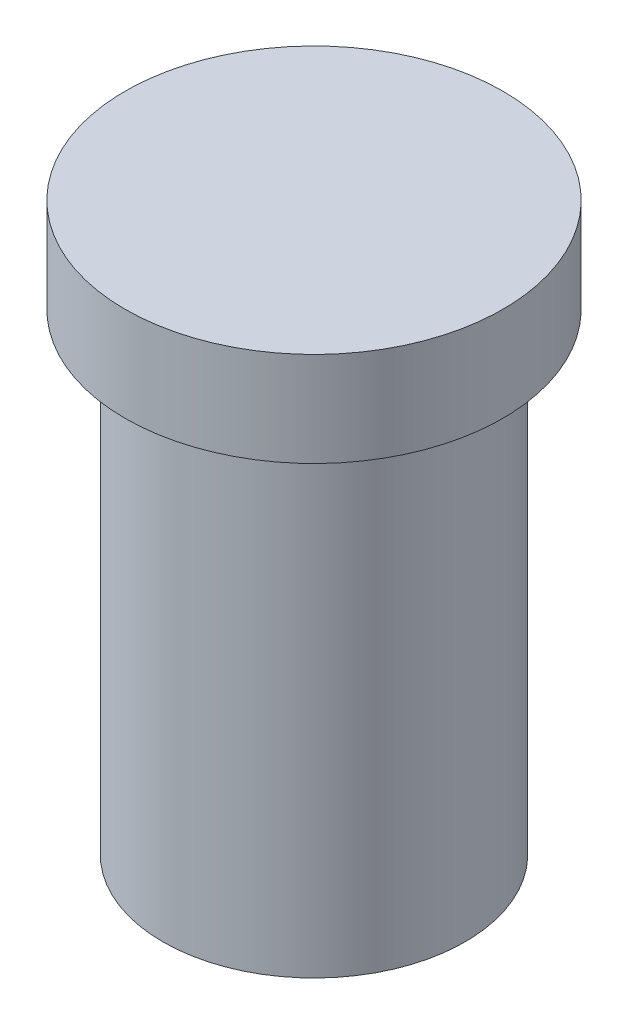
from build123d import *

# Parameters (mm, degrees)
SKETCH1_R           = 400
BOSS_EXTRUDE1_DEPTH = 1250
SKETCH2_R           = 500
BOSS_EXTRUDE2_DEPTH = 250


with BuildPart() as part:
    # Sketch1 → Boss-Extrude1 (new body)
    with BuildSketch(Plane(origin=(0, 0, 0), x_dir=(1, 0, 0), z_dir=(0, 1, 0))):
        Circle(SKETCH1_R)
    extrude(amount=BOSS_EXTRUDE1_DEPTH)

    # Sketch2 → Boss-Extrude2 (add)
    with BuildSketch(Plane(origin=(0, 1250, 0), x_dir=(1, 0, 0), z_dir=(0, 1, 0))):
        Circle(SKETCH2_R)
    extrude(amount=BOSS_EXTRUDE2_DEPTH)


solid = part.part
